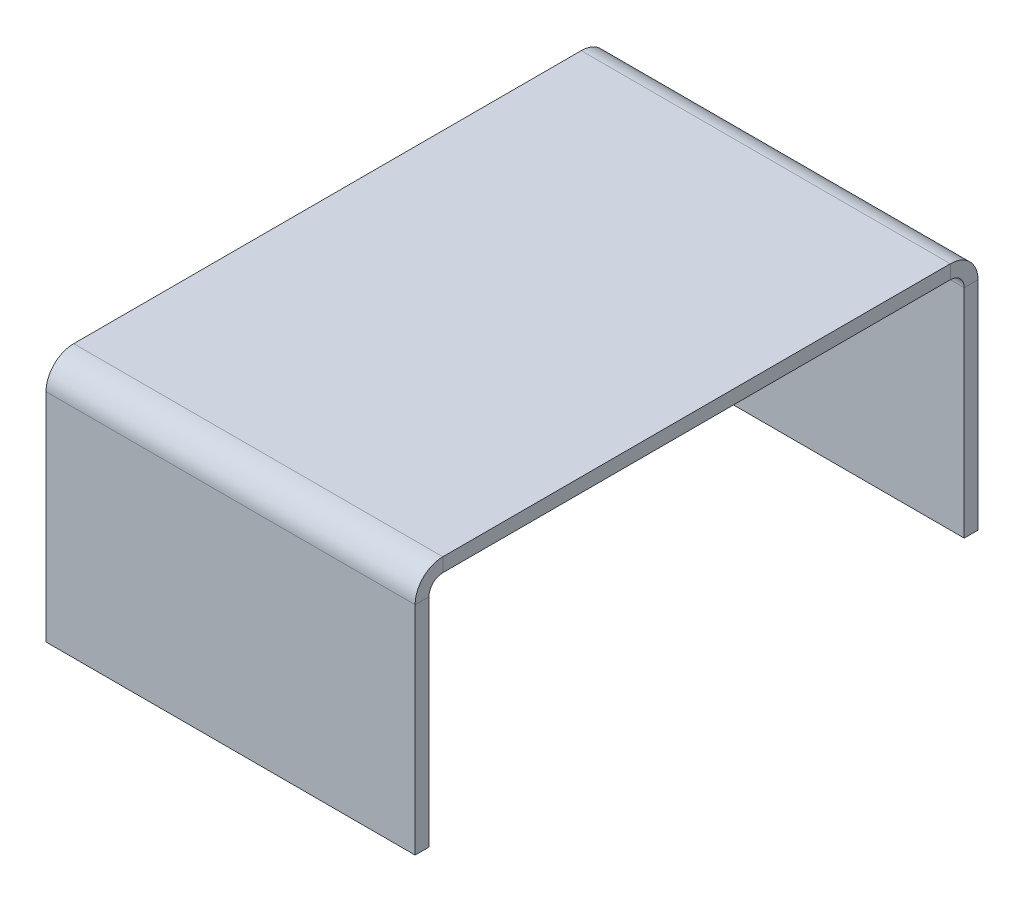
from build123d import *

# Parameters (mm, degrees)
EXTRUDE_1_DEPTH       = 40
SHEET_START           = -40
SHEET_METAL_1_DEPTH   = 80
SHEET_METAL_1_2_DEPTH = 80


# Read off the part's stored shape, not the designer's step: Преобразовать-Твердое тело1
with BuildPart() as part:
    # Sketch 1 → Вытянуть-Тонкостенный1 (new, symmetric)
    with BuildSketch(Plane(origin=(0, 0, 0), x_dir=(0, 0, -1), z_dir=(1, 0, 0))):
        Polygon((-58, -25), (-58, 25), (58, 25), (58, -25), (64, -25), (64, 31), (-64, 31), (-64, -25), align=None)
    extrude(amount=EXTRUDE_1_DEPTH, both=True)

    # Sheet Metal 1 outline → Sheet Metal 1 (cut)
    with BuildSketch(Plane.YZ.offset(SHEET_START)):
        with BuildLine():
            Line((-25, 64), (-25, 61))
            Line((-25, 61), (22, 61))
            ThreePointArc((22, 61), (26.242640687, 59.242640687), (28, 55))
            Line((28, 55), (28, -55))
            ThreePointArc((28, -55), (26.242640687, -59.242640687), (22, -61))
            Line((22, -61), (-25, -61))
            Line((-25, -61), (-25, -64))
            Line((-25, -64), (31, -64))
            Line((31, -64), (31, 64))
            Line((31, 64), (-25, 64))
        make_face()
    extrude(amount=SHEET_METAL_1_DEPTH, mode=Mode.SUBTRACT)

    # Sheet Metal 1 2 outline → Sheet Metal 1 2 (add)
    with BuildSketch(Plane.YZ.offset(SHEET_START)):
        with BuildLine():
            ThreePointArc((22, 58), (24.121320344, 57.121320344), (25, 55))
            Line((25, 55), (25, 58))
            Line((25, 58), (22, 58))
        make_face()
        with BuildLine():
            Line((25, -58), (25, -55))
            ThreePointArc((25, -55), (24.121320344, -57.121320344), (22, -58))
            Line((22, -58), (25, -58))
        make_face()
    extrude(amount=SHEET_METAL_1_2_DEPTH)


solid = part.part
